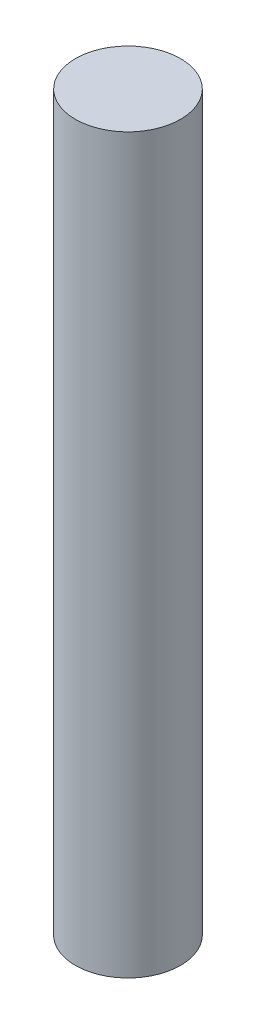
from build123d import *

# Parameters (mm, degrees)
SKETCH1_R           = 38.1
BOSS_EXTRUDE1_DEPTH = 530.86


with BuildPart() as part:
    # Sketch1 → Boss-Extrude1 (new body)
    with BuildSketch(Plane(origin=(0, 0, 0), x_dir=(1, 0, 0), z_dir=(0, 1, 0))):
        Circle(SKETCH1_R)
    extrude(amount=BOSS_EXTRUDE1_DEPTH)


solid = part.part
